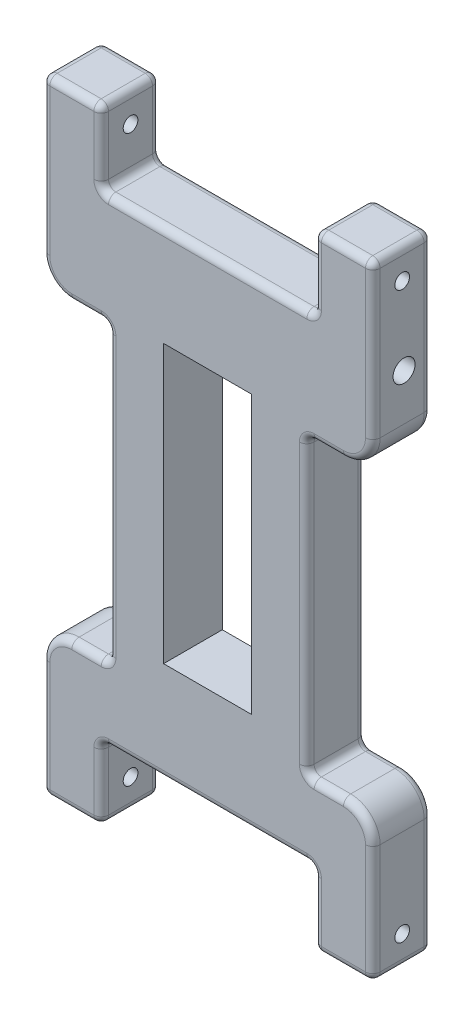
from build123d import *

# Parameters (mm, degrees)
SKETCH2_W           = 12
SKETCH2_H           = 37.77897706
BOSS_EXTRUDE1_DEPTH = 8
FILLET1_R           = 1
FILLET2_R           = 4
SKETCH3_R           = 1
CUT_EXTRUDE1_DEPTH  = 57.914409437
SKETCH4_R           = 1.5
CUT_EXTRUDE2_DEPTH  = 10


with BuildPart() as part:
    # Sketch2 → Boss-Extrude1 (new body)
    with BuildSketch(Plane.XY):
        Polygon((-22.5, -42.5), (-22.5, -22.5), (-13.5, -22.5), (-13.5, 17.5), (-22.5, 17.5), (-22.5, 42.5), (-14.5, 42.5), (-14.5, 32.5), (14.5, 32.5), (14.5, 42.5), (22.5, 42.5), (22.5, 17.5), (13.5, 17.5), (13.5, -22.5), (22.5, -22.5), (22.5, -42.5), (14.5, -42.5), (14.5, -32.5), (-14.5, -32.5), (-14.5, -42.5), align=None)
        Rectangle(SKETCH2_W, SKETCH2_H, mode=Mode.SUBTRACT)
    extrude(amount=BOSS_EXTRUDE1_DEPTH)

    # Fillet1
    fillet1_edges = [part.edges().sort_by_distance(p)[0] for p in [
        (0, -32.5, 8),
        (14.5, -37.5, 8),
        (-22.5, -32.5, 0),
        (-18, -22.5, 0),
        (-13.5, -2.5, 0),
        (-18, 17.5, 0),
        (18.5, -42.5, 8),
        (-22.5, 30, 0),
        (-18.5, 42.5, 0),
        (-14.5, 37.5, 0),
        (0, 32.5, 0),
        (14.5, 37.5, 0),
        (18.5, 42.5, 0),
        (22.5, 30, 0),
        (18, 17.5, 0),
        (13.5, -2.5, 0),
        (18, -22.5, 0),
        (22.5, -32.5, 8),
        (22.5, -32.5, 0),
        (18.5, -42.5, 0),
        (14.5, -37.5, 0),
        (0, -32.5, 0),
        (-14.5, -37.5, 0),
        (-18.5, -42.5, 0),
        (18, -22.5, 8),
        (13.5, -2.5, 8),
        (-22.5, -42.5, 4),
        (-13.5, -22.5, 4),
        (-13.5, 17.5, 4),
        (-22.5, 42.5, 4),
        (-14.5, 42.5, 4),
        (-14.5, 32.5, 4),
        (14.5, 32.5, 4),
        (14.5, 42.5, 4),
        (22.5, 42.5, 4),
        (13.5, 17.5, 4),
        (13.5, -22.5, 4),
        (22.5, -42.5, 4),
        (14.5, -42.5, 4),
        (14.5, -32.5, 4),
        (-14.5, -32.5, 4),
        (-14.5, -42.5, 4),
        (18, 17.5, 8),
        (22.5, 30, 8),
        (18.5, 42.5, 8),
        (14.5, 37.5, 8),
        (-18.5, -42.5, 8),
        (0, 32.5, 8),
        (-14.5, 37.5, 8),
        (-18.5, 42.5, 8),
        (-22.5, 30, 8),
        (-18, 17.5, 8),
        (-13.5, -2.5, 8),
        (-18, -22.5, 8),
        (-22.5, -32.5, 8),
        (-14.5, -37.5, 8),
    ]]
    fillet(fillet1_edges, radius=FILLET1_R)

    # Fillet2
    # the kernel refuses this fillet: 4 mm, written as the material it takes off along each edge
    with BuildSketch(Plane(origin=(18.5, 21.5, 8), x_dir=(0, -1, 0), z_dir=(-1, 0, 0))) as fillet2_piece_1:
        with BuildLine():
            CenterArc((3, -1), 1, 0, 90)
            Line((4, -1), (4, 0))
            Line((4, 0), (3, 0))
        make_face()
    revolve(axis=Axis((18.5, 21.5, 8), (0, 0, 1)), revolution_arc=90, mode=Mode.SUBTRACT)
    with BuildSketch(Plane(origin=(18.5, 21.5, 0), x_dir=(1, 0, 0), z_dir=(0, 1, 0))) as fillet2_piece_2:
        with BuildLine():
            CenterArc((3, -1), 1, 0, 90)
            Line((4, -1), (4, 0))
            Line((4, 0), (3, 0))
        make_face()
    revolve(axis=Axis((18.5, 21.5, 0), (0, 0, -1)), revolution_arc=90, mode=Mode.SUBTRACT)
    with BuildSketch(Plane(origin=(18.5, -26.5, 8), x_dir=(1, 0, 0), z_dir=(0, -1, 0))) as fillet2_piece_3:
        with BuildLine():
            CenterArc((3, -1), 1, 0, 90)
            Line((4, -1), (4, 0))
            Line((4, 0), (3, 0))
        make_face()
    revolve(axis=Axis((18.5, -26.5, 8), (0, 0, 1)), revolution_arc=90, mode=Mode.SUBTRACT)
    with BuildSketch(Plane(origin=(18.5, -26.5, 0), x_dir=(0, 1, 0), z_dir=(-1, 0, 0))) as fillet2_piece_4:
        with BuildLine():
            CenterArc((3, -1), 1, 0, 90)
            Line((4, -1), (4, 0))
            Line((4, 0), (3, 0))
        make_face()
    revolve(axis=Axis((18.5, -26.5, 0), (0, 0, -1)), revolution_arc=90, mode=Mode.SUBTRACT)
    with BuildSketch(Plane(origin=(-18.5, 21.5, 8), x_dir=(-1, 0, 0), z_dir=(0, 1, 0))) as fillet2_piece_5:
        with BuildLine():
            CenterArc((3, -1), 1, 0, 90)
            Line((4, -1), (4, 0))
            Line((4, 0), (3, 0))
        make_face()
    revolve(axis=Axis((-18.5, 21.5, 8), (0, 0, 1)), revolution_arc=90, mode=Mode.SUBTRACT)
    with BuildSketch(Plane(origin=(-18.5, 21.5, 0), x_dir=(0, -1, 0), z_dir=(1, 0, 0))) as fillet2_piece_6:
        with BuildLine():
            CenterArc((3, -1), 1, 0, 90)
            Line((4, -1), (4, 0))
            Line((4, 0), (3, 0))
        make_face()
    revolve(axis=Axis((-18.5, 21.5, 0), (0, 0, -1)), revolution_arc=90, mode=Mode.SUBTRACT)
    with BuildSketch(Plane(origin=(-18.5, -26.5, 8), x_dir=(0, 1, 0), z_dir=(1, 0, 0))) as fillet2_piece_7:
        with BuildLine():
            CenterArc((3, -1), 1, 0, 90)
            Line((4, -1), (4, 0))
            Line((4, 0), (3, 0))
        make_face()
    revolve(axis=Axis((-18.5, -26.5, 8), (0, 0, 1)), revolution_arc=90, mode=Mode.SUBTRACT)
    with BuildSketch(Plane(origin=(-18.5, -26.5, 0), x_dir=(-1, 0, 0), z_dir=(0, -1, 0))) as fillet2_piece_8:
        with BuildLine():
            CenterArc((3, -1), 1, 0, 90)
            Line((4, -1), (4, 0))
            Line((4, 0), (3, 0))
        make_face()
    revolve(axis=Axis((-18.5, -26.5, 0), (0, 0, -1)), revolution_arc=90, mode=Mode.SUBTRACT)
    with BuildSketch(Plane(origin=(-22.5, 17.5, 0), x_dir=(1, 0, 0), z_dir=(0, 0, 1)), Plane(origin=(-22.5, -22.5, 0), x_dir=(0, -1, 0), z_dir=(0, 0, 1))) as fillet2_piece_9:
        with BuildLine():
            CenterArc((FILLET2_R, FILLET2_R), FILLET2_R, 180, 90)
            Line((0, FILLET2_R), (0, 0))
            Line((0, 0), (FILLET2_R, 0))
        make_face()
    extrude(amount=8, mode=Mode.SUBTRACT)
    with BuildSketch(Plane(origin=(22.5, -22.5, 0), x_dir=(0, -1, 0), z_dir=(0, 0, 1)), Plane(origin=(22.5, 17.5, 0), x_dir=(-1, 0, 0), z_dir=(0, 0, 1))) as fillet2_piece_10:
        with BuildLine():
            CenterArc((FILLET2_R, -FILLET2_R), FILLET2_R, 90, 90)
            Line((0, -FILLET2_R), (0, 0))
            Line((0, 0), (FILLET2_R, 0))
        make_face()
    extrude(amount=8, mode=Mode.SUBTRACT)

    # Sketch3 → Cut-Extrude1 (cut, symmetric)
    with BuildSketch(Plane(origin=(-14.5, 0, 0), x_dir=(0, 0, -1), z_dir=(1, 0, 0))):
        with Locations((-4, -38.5)):
            Circle(SKETCH3_R)
    cut_extrude1 = extrude(amount=CUT_EXTRUDE1_DEPTH, both=True, mode=Mode.SUBTRACT)

    # Mirror1: Cut-Extrude1 across plane
    add(cut_extrude1.mirror(Plane.ZX), mode=Mode.SUBTRACT)

    # Sketch4 → Cut-Extrude2 (cut)
    with BuildSketch(Plane(origin=(22.5, 0, 0), x_dir=(0, 0, -1), z_dir=(1, 0, 0))):
        with Locations(Location((-3.742743768, 27.805, 0), (0, 0, 90))):
            Circle(SKETCH4_R)
    extrude(amount=-CUT_EXTRUDE2_DEPTH, mode=Mode.SUBTRACT)


solid = part.part
